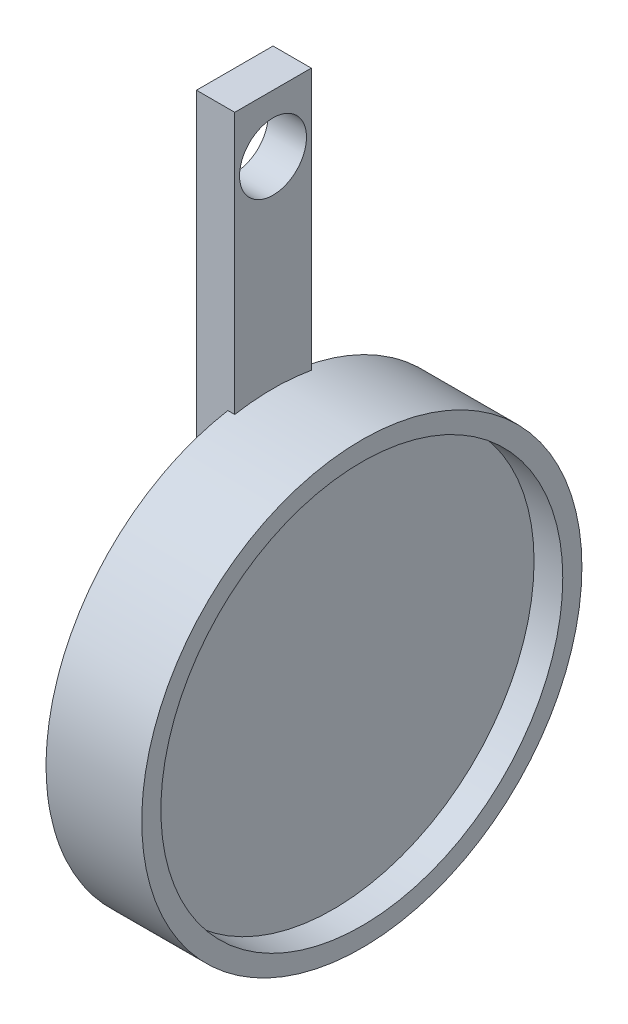
from build123d import *

# Parameters (mm, degrees)
SKETCH1_R           = 11.5
SKETCH1_R_2         = 10.5
BOSS_EXTRUDE1_DEPTH = 5
SKETCH1_2_R         = 10.5
BOSS_EXTRUDE2_DEPTH = 3.5
SKETCH3_R           = 9.5
CUT_EXTRUDE2_DEPTH  = 1.5
SKETCH6_W           = 30
SKETCH6_H           = 4
SKETCH6_R           = 1.75
BOSS_EXTRUDE3_DEPTH = 2


with BuildPart() as part:
    # Sketch1 → Boss-Extrude1 (new body)
    with BuildSketch(Plane.YZ):
        Circle(SKETCH1_R)
        Circle(SKETCH1_R_2, mode=Mode.SUBTRACT)
    extrude(amount=BOSS_EXTRUDE1_DEPTH)

    # Sketch1<2> → Boss-Extrude2 (add)
    with BuildSketch(Plane.YZ):
        Circle(SKETCH1_2_R)
    extrude(amount=BOSS_EXTRUDE2_DEPTH)

    # Sketch3 → Cut-Extrude2 (cut)
    with BuildSketch(Plane(origin=(0, 0, 0), x_dir=(0, -1, 0), z_dir=(-1, 0, 0))):
        Circle(SKETCH3_R)
    extrude(amount=-CUT_EXTRUDE2_DEPTH, mode=Mode.SUBTRACT)

    # Sketch4 for Loft1 → Loft1 section 0
    with BuildSketch(Plane(origin=(0, 0, 0), x_dir=(0, -1, 0), z_dir=(-1, 0, 0))):
        with BuildLine():
            # circular arc as an exact rational Bezier (weights 1, cos(half-angle), 1)
            Bezier((10.677481945, -4.270992778), (12.385879057, 0), (10.677481945, 4.270992778), weights=[1, 0.928476691, 1])
            Bezier((10.677481945, 4.270992778), (0, 30.964697642), (-10.677481945, 4.270992778), weights=[1, 0.371390676, 1])
            Bezier((-10.677481945, 4.270992778), (-12.385879057, 0), (-10.677481945, -4.270992778), weights=[1, 0.928476691, 1])
            Bezier((-10.677481945, -4.270992778), (0, -30.964697642), (10.677481945, -4.270992778), weights=[1, 0.371390676, 1])
        make_face()
    # Sketch2 → Loft1 section 1
    with BuildSketch(Plane.ZY.offset(1.64)):
        with BuildLine():
            Line((-2, -5), (2, -5))
            Line((2, -5), (2, 5))
            Line((2, 5), (-2, 5))
            Line((-2, 5), (-2, -5))
        make_face()
    loft()

    # Sketch6 → Boss-Extrude3 (add)
    with BuildSketch(Plane(origin=(-1.64, 0, 0), x_dir=(0, -1, 0), z_dir=(-1, 0, 0))):
        with Locations((-10, 0)):
            Rectangle(SKETCH6_W, SKETCH6_H)
        with Locations((-22, 0)):
            Circle(SKETCH6_R, mode=Mode.SUBTRACT)
    extrude(amount=-BOSS_EXTRUDE3_DEPTH)


solid = part.part
